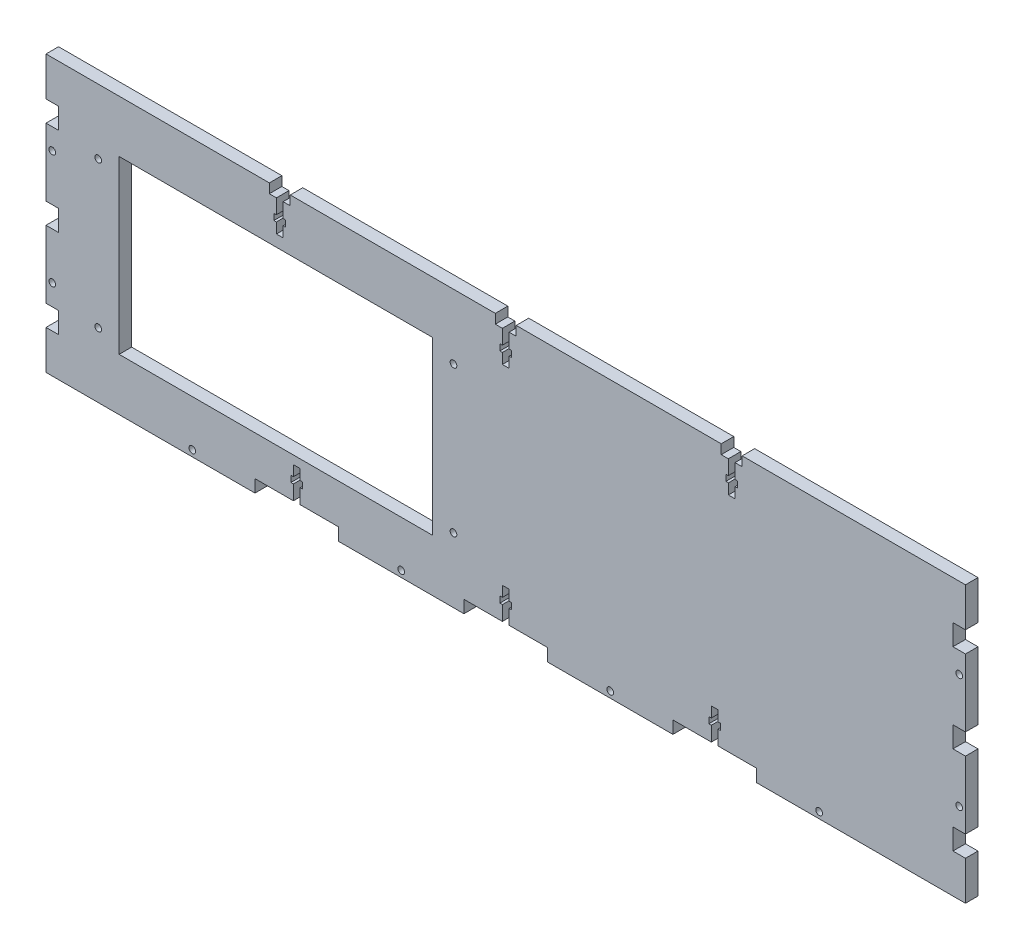
from build123d import *

# Parameters (mm, degrees)
SKETCH1_W           = 440
SKETCH1_H           = 132
BOSS_EXTRUDE1_DEPTH = 6
CUT_EXTRUDE1_REACH  = 231.765
SKETCH2_R           = 1.6
SKETCH2_W           = 6
SKETCH2_H           = 10
CUT_EXTRUDE2_REACH  = 231.765
SKETCH3_R           = 1.6
CUT_EXTRUDE3_REACH  = 231.765
SKETCH4_W           = 40
SKETCH4_H           = 6
SKETCH5_W           = 10
SKETCH5_H           = 6
CUT_EXTRUDE4_DEPTH  = 4.5
CUT_EXTRUDE5_REACH  = 231.765
SKETCH7_R           = 1.6
SKETCH7_W           = 150
SKETCH7_H           = 82
CUT_EXTRUDE6_DEPTH  = 230.765097436


with BuildPart() as part:
    # Sketch1 → Boss-Extrude1 (new body)
    with BuildSketch(Plane.XY):
        Rectangle(SKETCH1_W, SKETCH1_H)
    extrude(amount=BOSS_EXTRUDE1_DEPTH)

    # Sketch2 → Cut-Extrude1 (cut, up to next)
    with BuildSketch(Plane(origin=(0, 0, 0), x_dir=(-1, 0, 0), z_dir=(0, 0, -1)), mode=Mode.PRIVATE) as cut_extrude1_sk1:
        with Locations((217, 27.332128782)):
            Circle(SKETCH2_R)
    cut_extrude1_tool1 = extrude(cut_extrude1_sk1.sketch, amount=-CUT_EXTRUDE1_REACH, mode=Mode.PRIVATE) & part.part
    # Sketch2 → Cut-Extrude1 (cut, up to next)
    with BuildSketch(Plane(origin=(0, 0, 0), x_dir=(-1, 0, 0), z_dir=(0, 0, -1)), mode=Mode.PRIVATE) as cut_extrude1_sk2:
        with Locations((217, -27.332128782)):
            Circle(SKETCH2_R)
    cut_extrude1_tool2 = extrude(cut_extrude1_sk2.sketch, amount=-CUT_EXTRUDE1_REACH, mode=Mode.PRIVATE) & part.part
    # Sketch2 → Cut-Extrude1 (cut, up to next)
    with BuildSketch(Plane(origin=(0, 0, 0), x_dir=(-1, 0, 0), z_dir=(0, 0, -1)), mode=Mode.PRIVATE) as cut_extrude1_sk3:
        with Locations((-217, 27.332128782)):
            Circle(SKETCH2_R)
    cut_extrude1_tool3 = extrude(cut_extrude1_sk3.sketch, amount=-CUT_EXTRUDE1_REACH, mode=Mode.PRIVATE) & part.part
    # Sketch2 → Cut-Extrude1 (cut, up to next)
    with BuildSketch(Plane(origin=(0, 0, 0), x_dir=(-1, 0, 0), z_dir=(0, 0, -1)), mode=Mode.PRIVATE) as cut_extrude1_sk4:
        with Locations((-217, -27.332128782)):
            Circle(SKETCH2_R)
    cut_extrude1_tool4 = extrude(cut_extrude1_sk4.sketch, amount=-CUT_EXTRUDE1_REACH, mode=Mode.PRIVATE) & part.part
    # Sketch2 → Cut-Extrude1 (cut, up to next)
    with BuildSketch(Plane(origin=(0, 0, 0), x_dir=(-1, 0, 0), z_dir=(0, 0, -1)), mode=Mode.PRIVATE) as cut_extrude1_sk5:
        with Locations((217, 42.332128782)):
            Rectangle(SKETCH2_W, SKETCH2_H)
    cut_extrude1_tool5 = extrude(cut_extrude1_sk5.sketch, amount=-CUT_EXTRUDE1_REACH, mode=Mode.PRIVATE) & part.part
    # Sketch2 → Cut-Extrude1 (cut, up to next)
    with BuildSketch(Plane(origin=(0, 0, 0), x_dir=(-1, 0, 0), z_dir=(0, 0, -1)), mode=Mode.PRIVATE) as cut_extrude1_sk6:
        with Locations((217, -42.332128782)):
            Rectangle(SKETCH2_W, SKETCH2_H)
    cut_extrude1_tool6 = extrude(cut_extrude1_sk6.sketch, amount=-CUT_EXTRUDE1_REACH, mode=Mode.PRIVATE) & part.part
    # Sketch2 → Cut-Extrude1 (cut, up to next)
    with BuildSketch(Plane(origin=(0, 0, 0), x_dir=(-1, 0, 0), z_dir=(0, 0, -1)), mode=Mode.PRIVATE) as cut_extrude1_sk7:
        with Locations((-217, -42.332128782)):
            Rectangle(SKETCH2_W, SKETCH2_H)
    cut_extrude1_tool7 = extrude(cut_extrude1_sk7.sketch, amount=-CUT_EXTRUDE1_REACH, mode=Mode.PRIVATE) & part.part
    # Sketch2 → Cut-Extrude1 (cut, up to next)
    with BuildSketch(Plane(origin=(0, 0, 0), x_dir=(-1, 0, 0), z_dir=(0, 0, -1)), mode=Mode.PRIVATE) as cut_extrude1_sk8:
        with Locations((-217, 42.332128782)):
            Rectangle(SKETCH2_W, SKETCH2_H)
    cut_extrude1_tool8 = extrude(cut_extrude1_sk8.sketch, amount=-CUT_EXTRUDE1_REACH, mode=Mode.PRIVATE) & part.part
    # Sketch2 → Cut-Extrude1 (cut, up to next)
    with BuildSketch(Plane(origin=(0, 0, 0), x_dir=(-1, 0, 0), z_dir=(0, 0, -1)), mode=Mode.PRIVATE) as cut_extrude1_sk9:
        with Locations((217, 0)):
            Rectangle(SKETCH2_W, SKETCH2_H)
    cut_extrude1_tool9 = extrude(cut_extrude1_sk9.sketch, amount=-CUT_EXTRUDE1_REACH, mode=Mode.PRIVATE) & part.part
    # Sketch2 → Cut-Extrude1 (cut, up to next)
    with BuildSketch(Plane(origin=(0, 0, 0), x_dir=(-1, 0, 0), z_dir=(0, 0, -1)), mode=Mode.PRIVATE) as cut_extrude1_sk10:
        with Locations((-217, 0)):
            Rectangle(SKETCH2_W, SKETCH2_H)
    cut_extrude1_tool10 = extrude(cut_extrude1_sk10.sketch, amount=-CUT_EXTRUDE1_REACH, mode=Mode.PRIVATE) & part.part
    add(cut_extrude1_tool1.solids().sort_by_distance((-217, 27.332129, 0))[0], mode=Mode.SUBTRACT)
    add(cut_extrude1_tool2.solids().sort_by_distance((-217, -27.332129, 0))[0], mode=Mode.SUBTRACT)
    add(cut_extrude1_tool3.solids().sort_by_distance((217, 27.332129, 0))[0], mode=Mode.SUBTRACT)
    add(cut_extrude1_tool4.solids().sort_by_distance((217, -27.332129, 0))[0], mode=Mode.SUBTRACT)
    add(cut_extrude1_tool5.solids().sort_by_distance((-217, 42.332129, 0))[0], mode=Mode.SUBTRACT)
    add(cut_extrude1_tool6.solids().sort_by_distance((-217, -42.332129, 0))[0], mode=Mode.SUBTRACT)
    add(cut_extrude1_tool7.solids().sort_by_distance((217, -42.332129, 0))[0], mode=Mode.SUBTRACT)
    add(cut_extrude1_tool8.solids().sort_by_distance((217, 42.332129, 0))[0], mode=Mode.SUBTRACT)
    add(cut_extrude1_tool9.solids().sort_by_distance((-217, 0, 0))[0], mode=Mode.SUBTRACT)
    add(cut_extrude1_tool10.solids().sort_by_distance((217, 0, 0))[0], mode=Mode.SUBTRACT)

    # Sketch3 → Cut-Extrude2 (cut, up to next)
    with BuildSketch(Plane(origin=(0, 0, 0), x_dir=(-1, 0, 0), z_dir=(0, 0, -1)), mode=Mode.PRIVATE) as cut_extrude2_sk1:
        with Locations((-150, -63)):
            Circle(SKETCH3_R)
    cut_extrude2_tool1 = extrude(cut_extrude2_sk1.sketch, amount=-CUT_EXTRUDE2_REACH, mode=Mode.PRIVATE) & part.part
    # Sketch3 → Cut-Extrude2 (cut, up to next)
    with BuildSketch(Plane(origin=(0, 0, 0), x_dir=(-1, 0, 0), z_dir=(0, 0, -1)), mode=Mode.PRIVATE) as cut_extrude2_sk2:
        with Locations((-50, -63)):
            Circle(SKETCH3_R)
    cut_extrude2_tool2 = extrude(cut_extrude2_sk2.sketch, amount=-CUT_EXTRUDE2_REACH, mode=Mode.PRIVATE) & part.part
    # Sketch3 → Cut-Extrude2 (cut, up to next)
    with BuildSketch(Plane(origin=(0, 0, 0), x_dir=(-1, 0, 0), z_dir=(0, 0, -1)), mode=Mode.PRIVATE) as cut_extrude2_sk3:
        with Locations((50, -63)):
            Circle(SKETCH3_R)
    cut_extrude2_tool3 = extrude(cut_extrude2_sk3.sketch, amount=-CUT_EXTRUDE2_REACH, mode=Mode.PRIVATE) & part.part
    # Sketch3 → Cut-Extrude2 (cut, up to next)
    with BuildSketch(Plane(origin=(0, 0, 0), x_dir=(-1, 0, 0), z_dir=(0, 0, -1)), mode=Mode.PRIVATE) as cut_extrude2_sk4:
        with Locations((150, -63)):
            Circle(SKETCH3_R)
    cut_extrude2_tool4 = extrude(cut_extrude2_sk4.sketch, amount=-CUT_EXTRUDE2_REACH, mode=Mode.PRIVATE) & part.part
    add(cut_extrude2_tool1.solids().sort_by_distance((150, -63, 0))[0], mode=Mode.SUBTRACT)
    add(cut_extrude2_tool2.solids().sort_by_distance((50, -63, 0))[0], mode=Mode.SUBTRACT)
    add(cut_extrude2_tool3.solids().sort_by_distance((-50, -63, 0))[0], mode=Mode.SUBTRACT)
    add(cut_extrude2_tool4.solids().sort_by_distance((-150, -63, 0))[0], mode=Mode.SUBTRACT)

    # Sketch4 → Cut-Extrude3 (cut, up to next)
    with BuildSketch(Plane(origin=(0, 0, 0), x_dir=(-1, 0, 0), z_dir=(0, 0, -1)), mode=Mode.PRIVATE) as cut_extrude3_sk1:
        with Locations((100, -63)):
            Rectangle(SKETCH4_W, SKETCH4_H)
    cut_extrude3_tool1 = extrude(cut_extrude3_sk1.sketch, amount=-CUT_EXTRUDE3_REACH, mode=Mode.PRIVATE) & part.part
    # Sketch4 → Cut-Extrude3 (cut, up to next)
    with BuildSketch(Plane(origin=(0, 0, 0), x_dir=(-1, 0, 0), z_dir=(0, 0, -1)), mode=Mode.PRIVATE) as cut_extrude3_sk2:
        with Locations((0, -63)):
            Rectangle(SKETCH4_W, SKETCH4_H)
    cut_extrude3_tool2 = extrude(cut_extrude3_sk2.sketch, amount=-CUT_EXTRUDE3_REACH, mode=Mode.PRIVATE) & part.part
    # Sketch4 → Cut-Extrude3 (cut, up to next)
    with BuildSketch(Plane(origin=(0, 0, 0), x_dir=(-1, 0, 0), z_dir=(0, 0, -1)), mode=Mode.PRIVATE) as cut_extrude3_sk3:
        with Locations((-100, -63)):
            Rectangle(SKETCH4_W, SKETCH4_H)
    cut_extrude3_tool3 = extrude(cut_extrude3_sk3.sketch, amount=-CUT_EXTRUDE3_REACH, mode=Mode.PRIVATE) & part.part
    add(cut_extrude3_tool1.solids().sort_by_distance((-100, -63, 0))[0], mode=Mode.SUBTRACT)
    add(cut_extrude3_tool2.solids().sort_by_distance((0, -63, 0))[0], mode=Mode.SUBTRACT)
    add(cut_extrude3_tool3.solids().sort_by_distance((100, -63, 0))[0], mode=Mode.SUBTRACT)

    # Sketch5 → Cut-Extrude4 (cut)
    with BuildSketch(Plane(origin=(0, 66, 0), x_dir=(1, 0, 0), z_dir=(0, 1, 0))):
        with Locations((-108.125, -3)):
            Rectangle(SKETCH5_W, SKETCH5_H)
        with Locations((0, -3)):
            Rectangle(SKETCH5_W, SKETCH5_H)
        with Locations((108.125, -3)):
            Rectangle(SKETCH5_W, SKETCH5_H)
    extrude(amount=-CUT_EXTRUDE4_DEPTH, mode=Mode.SUBTRACT)

    # Sketch6 → Cut-Extrude5 (cut, up to next)
    with BuildSketch(Plane(origin=(0, 0, 0), x_dir=(-1, 0, 0), z_dir=(0, 0, -1)), mode=Mode.PRIVATE) as cut_extrude5_sk1:
        Polygon((-109.725, 61.5), (-109.725, 54.5), (-110.925, 54.5), (-110.925, 51.5), (-109.725, 51.5), (-109.725, 46.5), (-106.525, 46.5), (-106.525, 51.5), (-105.325, 51.5), (-105.325, 54.5), (-106.525, 54.5), (-106.525, 61.5), align=None)
    cut_extrude5_tool1 = extrude(cut_extrude5_sk1.sketch, amount=-CUT_EXTRUDE5_REACH, mode=Mode.PRIVATE) & part.part
    # Sketch6 → Cut-Extrude5 (cut, up to next)
    with BuildSketch(Plane(origin=(0, 0, 0), x_dir=(-1, 0, 0), z_dir=(0, 0, -1)), mode=Mode.PRIVATE) as cut_extrude5_sk2:
        Polygon((-1.595, 61.5), (-1.595, 54.5), (-2.795, 54.5), (-2.795, 51.5), (-1.595, 51.5), (-1.595, 46.5), (1.605, 46.5), (1.605, 51.5), (2.805, 51.5), (2.805, 54.5), (1.605, 54.5), (1.605, 61.5), align=None)
    cut_extrude5_tool2 = extrude(cut_extrude5_sk2.sketch, amount=-CUT_EXTRUDE5_REACH, mode=Mode.PRIVATE) & part.part
    # Sketch6 → Cut-Extrude5 (cut, up to next)
    with BuildSketch(Plane(origin=(0, 0, 0), x_dir=(-1, 0, 0), z_dir=(0, 0, -1)), mode=Mode.PRIVATE) as cut_extrude5_sk3:
        Polygon((106.535, 61.5), (106.535, 54.5), (105.335, 54.5), (105.335, 51.5), (106.535, 51.5), (106.535, 46.5), (109.735, 46.5), (109.735, 51.5), (110.935, 51.5), (110.935, 54.5), (109.735, 54.5), (109.735, 61.5), align=None)
    cut_extrude5_tool3 = extrude(cut_extrude5_sk3.sketch, amount=-CUT_EXTRUDE5_REACH, mode=Mode.PRIVATE) & part.part
    # Sketch6 → Cut-Extrude5 (cut, up to next)
    with BuildSketch(Plane(origin=(0, 0, 0), x_dir=(-1, 0, 0), z_dir=(0, 0, -1)), mode=Mode.PRIVATE) as cut_extrude5_sk4:
        Polygon((-98.4, -60), (-98.4, -53), (-97.2, -53), (-97.2, -50), (-98.4, -50), (-98.4, -45), (-101.6, -45), (-101.6, -50), (-102.8, -50), (-102.8, -53), (-101.6, -53), (-101.6, -60), align=None)
    cut_extrude5_tool4 = extrude(cut_extrude5_sk4.sketch, amount=-CUT_EXTRUDE5_REACH, mode=Mode.PRIVATE) & part.part
    # Sketch6 → Cut-Extrude5 (cut, up to next)
    with BuildSketch(Plane(origin=(0, 0, 0), x_dir=(-1, 0, 0), z_dir=(0, 0, -1)), mode=Mode.PRIVATE) as cut_extrude5_sk5:
        Polygon((1.6, -60), (1.6, -53), (2.8, -53), (2.8, -50), (1.6, -50), (1.6, -45), (-1.6, -45), (-1.6, -50), (-2.8, -50), (-2.8, -53), (-1.6, -53), (-1.6, -60), align=None)
    cut_extrude5_tool5 = extrude(cut_extrude5_sk5.sketch, amount=-CUT_EXTRUDE5_REACH, mode=Mode.PRIVATE) & part.part
    # Sketch6 → Cut-Extrude5 (cut, up to next)
    with BuildSketch(Plane(origin=(0, 0, 0), x_dir=(-1, 0, 0), z_dir=(0, 0, -1)), mode=Mode.PRIVATE) as cut_extrude5_sk6:
        Polygon((101.6, -60), (101.6, -53), (102.8, -53), (102.8, -50), (101.6, -50), (101.6, -45), (98.4, -45), (98.4, -50), (97.2, -50), (97.2, -53), (98.4, -53), (98.4, -60), align=None)
    cut_extrude5_tool6 = extrude(cut_extrude5_sk6.sketch, amount=-CUT_EXTRUDE5_REACH, mode=Mode.PRIVATE) & part.part
    add(cut_extrude5_tool1.solids().sort_by_distance((108.125, 53.869565, 0))[0], mode=Mode.SUBTRACT)
    add(cut_extrude5_tool2.solids().sort_by_distance((-0.005, 53.869565, 0))[0], mode=Mode.SUBTRACT)
    add(cut_extrude5_tool3.solids().sort_by_distance((-108.135, 53.869565, 0))[0], mode=Mode.SUBTRACT)
    add(cut_extrude5_tool4.solids().sort_by_distance((100, -52.369565, 0))[0], mode=Mode.SUBTRACT)
    add(cut_extrude5_tool5.solids().sort_by_distance((0, -52.369565, 0))[0], mode=Mode.SUBTRACT)
    add(cut_extrude5_tool6.solids().sort_by_distance((-100, -52.369565, 0))[0], mode=Mode.SUBTRACT)

    # Sketch7 → Cut-Extrude6 (cut, through all)
    with BuildSketch(Plane(origin=(0, 0, 0), x_dir=(-1, 0, 0), z_dir=(0, 0, -1))):
        with Locations((25, 35)):
            Circle(SKETCH7_R)
        with Locations((25, -35)):
            Circle(SKETCH7_R)
        with Locations((195, 35)):
            Circle(SKETCH7_R)
        with Locations((195, -35)):
            Circle(SKETCH7_R)
        with Locations((110, 0)):
            Rectangle(SKETCH7_W, SKETCH7_H)
    extrude(amount=-CUT_EXTRUDE6_DEPTH, mode=Mode.SUBTRACT)


solid = part.part
